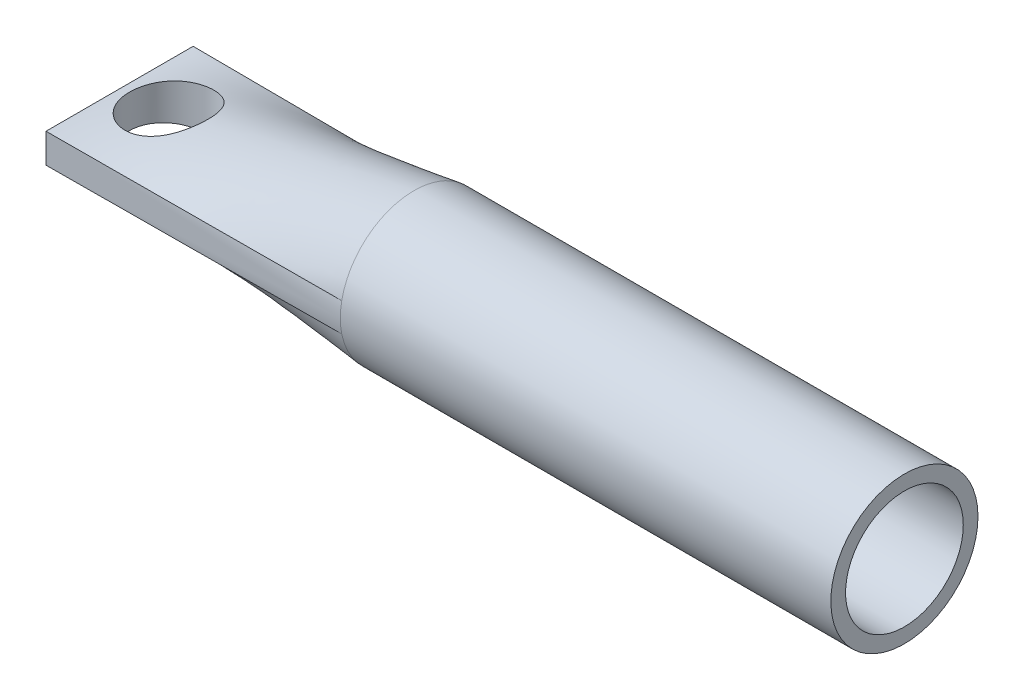
from build123d import *

# Parameters (mm, degrees)
SKETCH1_R           = 7.5
BOSS_EXTRUDE1_DEPTH = 50
SKETCH6_R           = 4
CUT_EXTRUDE1_DEPTH  = 10
SKETCH7_R           = 6
CUT_EXTRUDE2_DEPTH  = 15


with BuildPart() as part:
    # Sketch1 → Boss-Extrude1 (new body)
    with BuildSketch(Plane(origin=(0, 0, 0), x_dir=(0, 0, -1), z_dir=(1, 0, 0))):
        Circle(SKETCH1_R)
    extrude(amount=BOSS_EXTRUDE1_DEPTH)

    # Loft1: read off the stored shape, not the designer's step
    # Loft1: loft between two sections, ruled curve by curve
    loft1_from = [
        Edge.make_bspline([(-30, -1.5, -7.5), (-30, -1, -7.5), (-30, -0.5, -7.5), (-30, 0.5, -7.5), (-30, 1, -7.5), (-30, 1.5, -7.5)], [0, 0, 0, 0, 0.5, 0.5, 1, 1, 1, 1], 3),
        Edge.make_bspline([(-30, 1.5, -7.5), (-30, 1.5, -6.875), (-30, 1.5, -6.25), (-30, 1.5, -5), (-30, 1.5, -4.375), (-30, 1.5, -3.4375), (-30, 1.5, -3.125), (-30, 1.5, -2.5), (-30, 1.5, -2.1875), (-30, 1.5, -1.5625), (-30, 1.5, -1.25), (-30, 1.5, -0.625), (-30, 1.5, -0.3125), (-30, 1.5, 0.3125), (-30, 1.5, 0.625), (-30, 1.5, 1.25), (-30, 1.5, 1.5625), (-30, 1.5, 2.1875), (-30, 1.5, 2.5), (-30, 1.5, 3.125), (-30, 1.5, 3.4375), (-30, 1.5, 4.375), (-30, 1.5, 5), (-30, 1.5, 6.25), (-30, 1.5, 6.875), (-30, 1.5, 7.5)], [0, 0, 0, 0, 0.125, 0.125, 0.25, 0.25, 0.3125, 0.3125, 0.375, 0.375, 0.4375, 0.4375, 0.5, 0.5, 0.5625, 0.5625, 0.625, 0.625, 0.6875, 0.6875, 0.75, 0.75, 0.875, 0.875, 1, 1, 1, 1], 3),
        Edge.make_bspline([(-30, -1.5, 7.5), (-30, -1.5, 6.875), (-30, -1.5, 6.25), (-30, -1.5, 5), (-30, -1.5, 4.375), (-30, -1.5, 3.4375), (-30, -1.5, 3.125), (-30, -1.5, 2.5), (-30, -1.5, 2.1875), (-30, -1.5, 1.5625), (-30, -1.5, 1.25), (-30, -1.5, 0.625), (-30, -1.5, 0.3125), (-30, -1.5, -0.3125), (-30, -1.5, -0.625), (-30, -1.5, -1.25), (-30, -1.5, -1.5625), (-30, -1.5, -2.1875), (-30, -1.5, -2.5), (-30, -1.5, -3.125), (-30, -1.5, -3.4375), (-30, -1.5, -4.375), (-30, -1.5, -5), (-30, -1.5, -6.25), (-30, -1.5, -6.875), (-30, -1.5, -7.5)], [0, 0, 0, 0, 0.125, 0.125, 0.25, 0.25, 0.3125, 0.3125, 0.375, 0.375, 0.4375, 0.4375, 0.5, 0.5, 0.5625, 0.5625, 0.625, 0.625, 0.6875, 0.6875, 0.75, 0.75, 0.875, 0.875, 1, 1, 1, 1], 3),
        Edge.make_bspline([(-30, 1.5, 7.5), (-30, 1, 7.5), (-30, 0.5, 7.5), (-30, -0.5, 7.5), (-30, -1, 7.5), (-30, -1.5, 7.5)], [0, 0, 0, 0, 0.5, 0.5, 1, 1, 1, 1], 3),
    ]
    loft1_to = [
        Edge.make_bspline([(0, -1.470871014, -7.354355068), (0, -0.990101783, -7.450508914), (0, -0.495097568, -7.5), (0, 0.495097568, -7.5), (0, 0.990101783, -7.450508914), (0, 1.470871014, -7.354355068)], [0, 0, 0, 0, 0.5, 0.5, 1, 1, 1, 1], 3),
        Edge.make_bspline([(0, 1.470871014, -7.354355068), (0, 2.071832552, -7.23416276), (0, 2.721409951, -7.028293774), (0, 4.048575149, -6.357045286), (0, 4.726464289, -5.888995469), (0, 5.65014307, -4.951597355), (0, 5.941771026, -4.600489776), (0, 6.467728892, -3.825915851), (0, 6.701892794, -3.402414461), (0, 7.088758699, -2.498257653), (0, 7.24127756, -2.017672373), (0, 7.446959564, -1.024644209), (0, 7.5, -0.512377439), (0, 7.5, 0.512377439), (0, 7.446959564, 1.024644209), (0, 7.24127756, 2.017672373), (0, 7.088758699, 2.498257653), (0, 6.701892794, 3.402414461), (0, 6.467728892, 3.825915851), (0, 5.941771026, 4.600489776), (0, 5.65014307, 4.951597355), (0, 4.726464289, 5.888995469), (0, 4.048575149, 6.357045286), (0, 2.721409951, 7.028293774), (0, 2.071832552, 7.23416276), (0, 1.470871014, 7.354355068)], [0, 0, 0, 0, 0.125, 0.125, 0.25, 0.25, 0.3125, 0.3125, 0.375, 0.375, 0.4375, 0.4375, 0.5, 0.5, 0.5625, 0.5625, 0.625, 0.625, 0.6875, 0.6875, 0.75, 0.75, 0.875, 0.875, 1, 1, 1, 1], 3),
        Edge.make_bspline([(0, -1.470871014, 7.354355068), (0, -2.071832552, 7.23416276), (0, -2.721409951, 7.028293774), (0, -4.048575149, 6.357045286), (0, -4.726464289, 5.888995469), (0, -5.65014307, 4.951597355), (0, -5.941771026, 4.600489776), (0, -6.467728892, 3.825915851), (0, -6.701892794, 3.402414461), (0, -7.088758699, 2.498257653), (0, -7.24127756, 2.017672373), (0, -7.446959564, 1.024644209), (0, -7.5, 0.512377439), (0, -7.5, -0.512377439), (0, -7.446959564, -1.024644209), (0, -7.24127756, -2.017672373), (0, -7.088758699, -2.498257653), (0, -6.701892794, -3.402414461), (0, -6.467728892, -3.825915851), (0, -5.941771026, -4.600489776), (0, -5.65014307, -4.951597355), (0, -4.726464289, -5.888995469), (0, -4.048575149, -6.357045286), (0, -2.721409951, -7.028293774), (0, -2.071832552, -7.23416276), (0, -1.470871014, -7.354355068)], [0, 0, 0, 0, 0.125, 0.125, 0.25, 0.25, 0.3125, 0.3125, 0.375, 0.375, 0.4375, 0.4375, 0.5, 0.5, 0.5625, 0.5625, 0.625, 0.625, 0.6875, 0.6875, 0.75, 0.75, 0.875, 0.875, 1, 1, 1, 1], 3),
        Edge.make_bspline([(0, 1.470871014, 7.354355068), (0, 0.990101783, 7.450508914), (0, 0.495097568, 7.5), (0, -0.495097568, 7.5), (0, -0.990101783, 7.450508914), (0, -1.470871014, 7.354355068)], [0, 0, 0, 0, 0.5, 0.5, 1, 1, 1, 1], 3),
    ]
    loft1 = Solid(Shell([*[Face.make_surface_from_curves(loft1_from[k], loft1_to[k]) for k in range(4)], Face(Wire(loft1_from)), Face(Wire(loft1_to))]))
    add(loft1)

    # Sketch6 → Cut-Extrude1 (cut, symmetric)
    with BuildSketch(Plane(origin=(0, 0, 0), x_dir=(1, 0, 0), z_dir=(0, 1, 0))):
        with Locations(Location((-25, 0, 0), (0, 0, 270))):
            Circle(SKETCH6_R)
    extrude(amount=CUT_EXTRUDE1_DEPTH, both=True, mode=Mode.SUBTRACT)

    # Sketch7 → Cut-Extrude2 (cut)
    with BuildSketch(Plane(origin=(50, 0, 0), x_dir=(0, 0, -1), z_dir=(1, 0, 0))):
        Circle(SKETCH7_R)
    extrude(amount=-CUT_EXTRUDE2_DEPTH, mode=Mode.SUBTRACT)


solid = part.part
